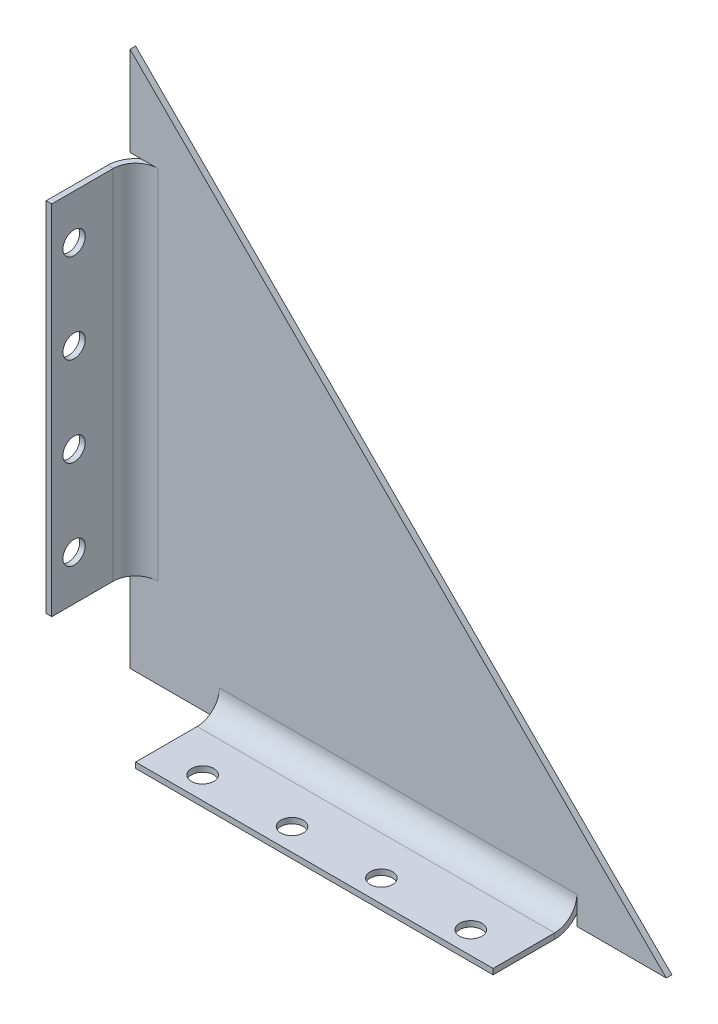
from build123d import *

# Parameters (mm, degrees)
BOSS_EXTRUDE1_DEPTH          = 1.5875
SKETCH7_W                    = 1.5875
SKETCH7_H                    = 101.6
BOSS_EXTRUDE2_DEPTH          = 0.0254
EDGE_FLANGE1_STRIP_W         = 19.05
EDGE_FLANGE1_STRIP_H         = 1.5875
EDGE_FLANGE1_STRIP_CUT_DEPTH = 101.6
EDGE_FLANGE1_DEPTH           = 101.6
SKETCH11_W                   = 101.6
SKETCH11_H                   = 1.5875
BOSS_EXTRUDE3_DEPTH          = 0.0254
EDGE_FLANGE2_STRIP_W         = 19.05
EDGE_FLANGE2_STRIP_H         = 1.5875
EDGE_FLANGE2_STRIP_CUT_DEPTH = 101.6
EDGE_FLANGE2_DEPTH           = 101.6
SKETCH15_R                   = 3.175
CUT_EXTRUDE1_DEPTH           = 2.54
SKETCH16_R                   = 3.175
CUT_EXTRUDE2_DEPTH           = 2.54


# Sheet-metal steps are written as plain solids
with BuildPart() as part:
    # Sketch1 → Boss-Extrude1 (new body)
    with BuildSketch(Plane.XY):
        Polygon((0, 119.481843199), (0, -32.918156801), (152.4, -32.918156801), align=None)
    extrude(amount=BOSS_EXTRUDE1_DEPTH)

    # Sketch7 → Boss-Extrude2 (add)
    with BuildSketch(Plane.ZY):
        with Locations((0.79375, 43.281843199)):
            Rectangle(SKETCH7_W, SKETCH7_H)
    extrude(amount=BOSS_EXTRUDE2_DEPTH)

    # Edge-Flange1 strip (across the edge) → Edge-Flange1 strip cut (cut)
    with BuildSketch(Plane(origin=(-0.0254, 94.081843199, 1.5875), x_dir=(1, 0, 0), z_dir=(0, -1, 0))):
        with Locations((-1.5875, -0.79375)):
            Rectangle(EDGE_FLANGE1_STRIP_W, EDGE_FLANGE1_STRIP_H)
    extrude(amount=EDGE_FLANGE1_STRIP_CUT_DEPTH, mode=Mode.SUBTRACT)

    # Edge-Flange1 section (across the edge) → Edge-Flange1 (add)
    with BuildSketch(Plane(origin=(-0.0254, 94.081843199, 1.5875), x_dir=(1, 0, 0), z_dir=(0, -1, 0))):
        with BuildLine():
            Line((0, 6.35), (0, 23.8125))
            Line((0, 23.8125), (1.5875, 23.8125))
            Line((1.5875, 23.8125), (1.5875, 6.35))
            ThreePointArc((1.5875, 6.35), (3.447371939, 1.859871939), (7.9375, 0))
            Line((7.9375, 0), (7.9375, -1.5875))
            ThreePointArc((7.9375, -1.5875), (2.324839924, 0.737339924), (0, 6.35))
        make_face()
    extrude(amount=EDGE_FLANGE1_DEPTH)

    # Sketch11 → Boss-Extrude3 (add)
    with BuildSketch(Plane(origin=(0, -32.918156801, 0), x_dir=(-1, 0, 0), z_dir=(0, -1, 0))):
        with Locations((-76.2, -0.79375)):
            Rectangle(SKETCH11_W, SKETCH11_H)
    extrude(amount=BOSS_EXTRUDE3_DEPTH)

    # Edge-Flange2 strip (across the edge) → Edge-Flange2 strip cut (cut)
    with BuildSketch(Plane(origin=(25.4, -32.943556801, 1.5875), x_dir=(0, 1, 0), z_dir=(1, 0, 0))):
        with Locations((-1.5875, -0.79375)):
            Rectangle(EDGE_FLANGE2_STRIP_W, EDGE_FLANGE2_STRIP_H)
    extrude(amount=EDGE_FLANGE2_STRIP_CUT_DEPTH, mode=Mode.SUBTRACT)

    # Edge-Flange2 section (across the edge) → Edge-Flange2 (add)
    with BuildSketch(Plane(origin=(25.4, -32.943556801, 1.5875), x_dir=(0, 1, 0), z_dir=(1, 0, 0))):
        with BuildLine():
            Line((0, 6.35), (0, 23.8125))
            Line((0, 23.8125), (1.5875, 23.8125))
            Line((1.5875, 23.8125), (1.5875, 6.35))
            ThreePointArc((1.5875, 6.35), (3.447371939, 1.859871939), (7.9375, 0))
            Line((7.9375, 0), (7.9375, -1.5875))
            ThreePointArc((7.9375, -1.5875), (2.324839924, 0.737339924), (0, 6.35))
        make_face()
    extrude(amount=EDGE_FLANGE2_DEPTH)

    # Sketch15 → Cut-Extrude1 (cut)
    with BuildSketch(Plane(origin=(0, -31.356056801, 0), x_dir=(1, 0, 0), z_dir=(0, 1, 0))):
        with Locations(Location((38.1, -19.05, 0), (0, 0, 270))):
            Circle(SKETCH15_R)
        with Locations(Location((63.5, -19.05, 0), (0, 0, 270))):
            Circle(SKETCH15_R)
        with Locations(Location((88.9, -19.05, 0), (0, 0, 270))):
            Circle(SKETCH15_R)
        with Locations(Location((114.3, -19.05, 0), (0, 0, 270))):
            Circle(SKETCH15_R)
    extrude(amount=-CUT_EXTRUDE1_DEPTH, mode=Mode.SUBTRACT)

    # Sketch16 → Cut-Extrude2 (cut)
    with BuildSketch(Plane(origin=(1.5621, 0, 0), x_dir=(0, 0, -1), z_dir=(1, 0, 0))):
        with Locations((-19.05, 81.381843199)):
            Circle(SKETCH16_R)
        with Locations((-19.05, 55.981843199)):
            Circle(SKETCH16_R)
        with Locations((-19.05, 30.581843199)):
            Circle(SKETCH16_R)
        with Locations((-19.05, 5.181843199)):
            Circle(SKETCH16_R)
    extrude(amount=-CUT_EXTRUDE2_DEPTH, mode=Mode.SUBTRACT)


solid = part.part
